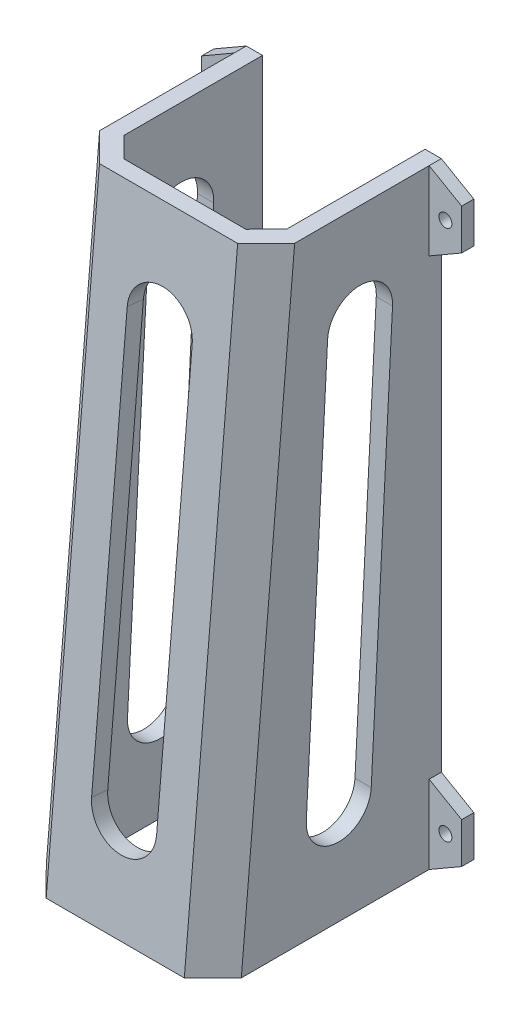
from build123d import *

# Parameters (mm, degrees)
BOSS_EXTRUDE1_START   = -24
BOSS_EXTRUDE1_DEPTH   = 4
BOSS_EXTRUDE1_START_2 = 20
BOSS_EXTRUDE1_2_DEPTH = 4
SKETCH3_W             = 48
SKETCH3_H             = 150.572975632
BOSS_EXTRUDE2_DEPTH   = 4
SKETCH4_W             = 87.955919885
SKETCH4_H             = 41.238898543
CUT_EXTRUDE1_DEPTH    = 10
CHAMFER1_SIZE         = 5
CHAMFER2_SIZE         = 7
CUT_EXTRUDE2_DEPTH    = 100
BOSS_EXTRUDE3_REACH   = 158.663
SKETCH7_R             = 1.6
BOSS_EXTRUDE4_DEPTH   = 3
CUT_EXTRUDE3_DEPTH    = 13


# Read off the part's stored shape, not the designer's step: Boss-Extrude1
with BuildPart() as part:
    # Boss-Extrude1 outline → Boss-Extrude1 (new body)
    with BuildSketch(Plane.YZ.offset(BOSS_EXTRUDE1_START)):
        Polygon((-230, 56.247033646), (-230, 0), (-80, 0), (-80, 43.123734117), align=None)
    extrude(amount=BOSS_EXTRUDE1_DEPTH)



with BuildPart() as body_2:
    # Boss-Extrude1 2 outline → Boss-Extrude1 2 (new body)
    with BuildSketch(Plane.YZ.offset(BOSS_EXTRUDE1_START_2)):
        Polygon((-230, 56.247033646), (-230, 0), (-80, 0), (-80, 43.123734117), align=None)
    extrude(amount=BOSS_EXTRUDE1_2_DEPTH)


with BuildPart() as part_1:
    add(part.part)

    add(body_2.part)  # Boss-Extrude2 merges body 2
    # Sketch3 → Boss-Extrude2 (add)
    with BuildSketch(Plane(origin=(0, 3.136489042, 35.850233801), x_dir=(1, 0, 0), z_dir=(-5.546132053355945e-15, 0.08715574274765837, 0.9961946980917457))):
        with Locations((0, -158.74054474)):
            Rectangle(SKETCH3_W, SKETCH3_H)
    extrude(amount=-BOSS_EXTRUDE2_DEPTH)

    # Sketch4 → Cut-Extrude1 (cut)
    with BuildSketch(Plane.XZ.offset(230)):
        with Locations((0.013546112, 51.627258861)):
            Rectangle(SKETCH4_W, SKETCH4_H)
    extrude(amount=CUT_EXTRUDE1_DEPTH, mode=Mode.SUBTRACT)

    # Chamfer1
    chamfer1_edges = [part_1.edges().sort_by_distance(p)[0] for p in [
        (-20, -155.174311485, 45.685354811),
        (20, -155.174311485, 45.685354811),
    ]]
    chamfer(chamfer1_edges, length=CHAMFER1_SIZE)

    # Chamfer2
    # the kernel refuses this chamfer: 7 mm, written as the material it takes off along each edge
    with BuildSketch(Plane(origin=(24, -62.066721296, 41.55477553), x_dir=(0.027495876610592048, -0.08712279063597585, -0.9958180537232768), z_dir=(0, -0.9961946980916814, 0.0871557427483924)), Plane(origin=(-24, -62.066721296, 41.55477553), x_dir=(0.9996219169112968, 0.0023964235485137053, 0.027391246498848068), z_dir=(0, -0.9961946980916814, 0.0871557427483924))) as chamfer2_piece_1:
        Polygon((CHAMFER2_SIZE * 0.999621916911, -CHAMFER2_SIZE * 0.0274958766106), (-CHAMFER2_SIZE * 0.0274958766106, -CHAMFER2_SIZE * 0.999621916911), (0, 0), align=None)
    extrude(amount=186.576537463, mode=Mode.SUBTRACT)

    # Sketch5 → Cut-Extrude2 (cut)
    with BuildSketch(Plane.ZY.offset(24)):
        with BuildLine():
            Line((27.989036278, -104.58131235), (33.229814206, -204.58131235))
            ThreePointArc((33.229814206, -204.58131235), (25.659465578, -212.989036278), (17.25174165, -205.41868765))
            Line((17.25174165, -205.41868765), (12.010963722, -105.41868765))
            ThreePointArc((12.010963722, -105.41868765), (19.58131235, -97.010963722), (27.989036278, -104.58131235))
        make_face()
    extrude(amount=-CUT_EXTRUDE2_DEPTH, mode=Mode.SUBTRACT)

    # Boss-Extrude3: up to this face of the body (flat: up to its plane)
    boss_extrude3_end = Plane(part_1.part.faces().sort_by_distance((21.96487497, -80, 19.069947066))[0])
    # Sketch6 → Boss-Extrude3 (add, up to the picked face)
    with BuildSketch(Plane(origin=(0, -83.136489042, 7.273500317), x_dir=(1, 0, 0), z_dir=(0, 0.9961946980917457, -0.0871557427476584)), mode=Mode.PRIVATE) as boss_extrude3_sk1:
        Polygon((20, -32.98717587), (20, -26.98717587), (15, -31.98717587), (-15, -31.98717587), (-20, -26.98717587), (-20, -32.98717587), (-17, -35.98717587), (17, -35.98717587), align=None)
    boss_extrude3_tool1 = split(extrude(boss_extrude3_sk1.sketch, amount=BOSS_EXTRUDE3_REACH, mode=Mode.PRIVATE), bisect_by=boss_extrude3_end, keep=Keep.BOTH, mode=Mode.PRIVATE)
    add(boss_extrude3_tool1.solids().sort_by(Axis((0, -80.224162, 40.561552), (0, 0.9961946980917457, -0.0871557427476584)))[0])

    # Sketch7 → Boss-Extrude4 (add)
    # profile 1 of 4: a face of its own
    with BuildSketch(Plane(origin=(0, 0, 0), x_dir=(-1, 0, 0), z_dir=(0, 0, -1))):
        Polygon((-24, -80), (-32, -84.618802154), (-32, -94.618802154), (-24, -99.237604307), align=None)
        with Locations((-28, -89.618802154)):
            Circle(SKETCH7_R, mode=Mode.SUBTRACT)
    # profile 2 of 4: a face of its own
    with BuildSketch(Plane(origin=(0, 0, 0), x_dir=(-1, 0, 0), z_dir=(0, 0, -1))):
        Polygon((-24, -210.762395693), (-24, -230), (-32, -225.381197846), (-32, -215.381197846), align=None)
        with Locations(Location((-28, -220.381197846, 0), (0, 0, 180))):
            Circle(SKETCH7_R, mode=Mode.SUBTRACT)
    # profile 3 of 4: a face of its own
    with BuildSketch(Plane(origin=(0, 0, 0), x_dir=(-1, 0, 0), z_dir=(0, 0, -1))):
        Polygon((24, -230), (32, -225.381197846), (32, -215.381197846), (24, -210.762395693), align=None)
        with Locations((28, -220.381197846)):
            Circle(SKETCH7_R, mode=Mode.SUBTRACT)
    # profile 4 of 4: a face of its own
    with BuildSketch(Plane(origin=(0, 0, 0), x_dir=(-1, 0, 0), z_dir=(0, 0, -1))):
        Polygon((24, -99.237604307), (24, -80), (32, -84.618802154), (32, -94.618802154), align=None)
        with Locations(Location((28, -89.618802154, 0), (0, 0, 180))):
            Circle(SKETCH7_R, mode=Mode.SUBTRACT)
    extrude(amount=-BOSS_EXTRUDE4_DEPTH)

    # Sketch8 → Cut-Extrude3 (cut)
    with BuildSketch(Plane(origin=(0, 3.136489042, 35.850233801), x_dir=(1, 0, 0), z_dir=(-5.546132053355945e-15, 0.08715574274765837, 0.9961946980917457))):
        with BuildLine():
            Line((8, -108.454056924), (8, -209.027032556))
            ThreePointArc((8, -209.027032556), (0, -217.027032556), (-8, -209.027032556))
            Line((-8, -209.027032556), (-8, -108.454056924))
            ThreePointArc((-8, -108.454056924), (0, -100.454056924), (8, -108.454056924))
        make_face()
    extrude(amount=-CUT_EXTRUDE3_DEPTH, mode=Mode.SUBTRACT)


solid = part_1.part
